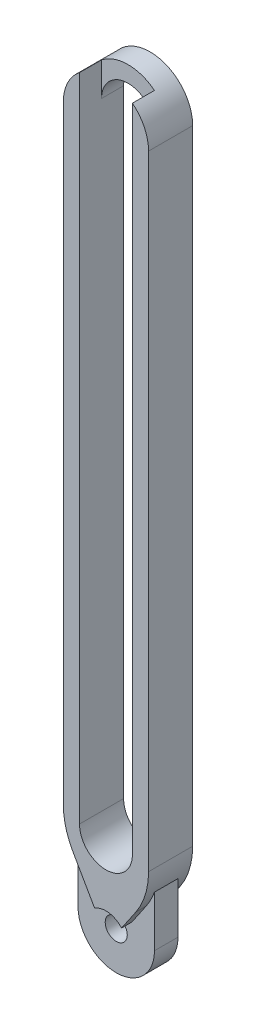
from build123d import *

# Parameters (mm, degrees)
ESTRUSIONE_ESTRUSIONE1_DEPTH = 7.5
ESTRUSIONE_ESTRUSIONE2_DEPTH = 4
TAGLIO_ESTRUSIONE1_DEPTH     = 198.380910943
TAGLIO_ESTRUSIONE2_DEPTH     = 198.380910943
RACCORDO1_R                  = 25
FORO_PER_VITE_M6_5_1_D       = 7.5
TAGLIO_ESTRUSIONE3_DEPTH     = 7.5
TAGLIO_ESTRUSIONE4_DEPTH     = 7.5


with BuildPart() as part:
    # Schizzo1 → Estrusione-Estrusione1 (new, symmetric)
    with BuildSketch(Plane.XY):
        with BuildLine():
            Line((14.5, 182.011383906), (14.5, -37.988616094))
            ThreePointArc((14.5, -37.988616094), (0, -52.488616094), (-14.5, -37.988616094))
            Line((-14.5, -37.988616094), (-14.5, 182.011383906))
            ThreePointArc((-14.5, 182.011383906), (0, 196.511383906), (14.5, 182.011383906))
        make_face()
    extrude(amount=ESTRUSIONE_ESTRUSIONE1_DEPTH, both=True)

    # Schizzo2 → Estrusione-Estrusione2 (add, symmetric)
    with BuildSketch(Plane.XY):
        with BuildLine():
            Line((13, -40.066616094), (13, -56.066616094))
            ThreePointArc((13, -56.066616094), (0, -69.066616094), (-13, -56.066616094))
            Line((-13, -56.066616094), (-13, -40.066616094))
            ThreePointArc((-13, -40.066616094), (0, -27.066616094), (13, -40.066616094))
        make_face()
    extrude(amount=ESTRUSIONE_ESTRUSIONE2_DEPTH, both=True)

    # Schizzo4 → Taglio-Estrusione1 (cut, through all)
    with BuildSketch(Plane.XY.offset(4)):
        with BuildLine():
            Line((5.29445937, -51.487456784), (14.5, -37.988616094))
            Line((14.5, -37.988616094), (21.494330869, -44.738036439))
            Line((21.494330869, -44.738036439), (5.386515672, -60.537124892))
            ThreePointArc((5.386515672, -60.537124892), (0.071202698, -63.066253954), (-5.29445937, -60.645775404))
            Line((-5.29445937, -60.645775404), (-28.596127717, -39.453615031))
            Line((-28.596127717, -39.453615031), (-14.5, -31.562211214))
            Line((-14.5, -31.562211214), (-3.845832517, -50.217721134))
            ThreePointArc((-3.845832517, -50.217721134), (0.963165144, -49.133196093), (5.29445937, -51.487456784))
        make_face()
    taglio_estrusione1 = extrude(amount=TAGLIO_ESTRUSIONE1_DEPTH, mode=Mode.SUBTRACT)

    # Specchia1: Taglio-Estrusione1 across plane
    add(taglio_estrusione1.mirror(Plane.XY), mode=Mode.SUBTRACT)

    # Schizzo5 → Taglio-Estrusione2 (cut, through all)
    with BuildSketch(Plane.XY.offset(4)):
        Polygon((-13, -44.411232383), (-13, -34.188720036), (-15.056335757, -30.588064032), (-15.056335757, -43.619366988), align=None)
        Polygon((13, -44.411232383), (13, -40.188189356), (17.407959402, -33.724436261), (17.407959402, -44.411232383), align=None)
    extrude(amount=-TAGLIO_ESTRUSIONE2_DEPTH, mode=Mode.SUBTRACT)

    # Raccordo1
    # the kernel refuses this fillet: 25 mm, written as the material it takes off along each edge
    with BuildSketch(Plane(origin=(-14.5, -31.562211214, -24.089497944), x_dir=(0.4959240379913526, -0.8683659070589721, 0), z_dir=(0, 0, 1))) as raccordo1_piece_1_section:
        with BuildLine():
            CenterArc((RACCORDO1_R * 0.26543196711, RACCORDO1_R), RACCORDO1_R, 240.269299078, 29.730700922)
            Line((-RACCORDO1_R * 0.230492070882, RACCORDO1_R * 0.131634092941), (0, 0))
            Line((0, 0), (RACCORDO1_R * 0.26543196711, 0))
        make_face()
    raccordo1_piece_1 = extrude(amount=48.178995889, mode=Mode.PRIVATE)
    raccordo1_piece_1 = split(raccordo1_piece_1, bisect_by=Plane(origin=(-13, -35.788331904, -14.044748972), z_dir=(1, 0, 0)), keep=Keep.TOP, mode=Mode.PRIVATE)
    raccordo1_piece_1 = split(raccordo1_piece_1, bisect_by=Plane(origin=(-12.28179921, -35.788331904, -4), z_dir=(0, 0, -1)), keep=Keep.TOP, mode=Mode.PRIVATE)
    add(raccordo1_piece_1, mode=Mode.SUBTRACT)
    with BuildSketch(Plane(origin=(-14.5, -31.562211214, -24.089497944), x_dir=(0.4959240379913526, -0.8683659070589721, 0), z_dir=(0, 0, 1))) as raccordo1_piece_2_section:
        with BuildLine():
            CenterArc((RACCORDO1_R * 0.26543196711, RACCORDO1_R), RACCORDO1_R, 240.269299078, 29.730700922)
            Line((-RACCORDO1_R * 0.230492070882, RACCORDO1_R * 0.131634092941), (0, 0))
            Line((0, 0), (RACCORDO1_R * 0.26543196711, 0))
        make_face()
    raccordo1_piece_2 = extrude(amount=48.178995889, mode=Mode.PRIVATE)
    raccordo1_piece_2 = split(raccordo1_piece_2, bisect_by=Plane(origin=(-13, -30.370530988, -14.044748972), z_dir=(-1, 0, 0)), keep=Keep.TOP, mode=Mode.PRIVATE)
    raccordo1_piece_2 = split(raccordo1_piece_2, bisect_by=Plane(origin=(-14.266276842, -30.370530988, -4), z_dir=(0, 0, -1)), keep=Keep.TOP, mode=Mode.PRIVATE)
    add(raccordo1_piece_2, mode=Mode.SUBTRACT)
    with BuildSketch(Plane(origin=(-14.5, -31.562211214, -24.089497944), x_dir=(0.4959240379913526, -0.8683659070589721, 0), z_dir=(0, 0, 1))) as raccordo1_piece_3_section:
        with BuildLine():
            CenterArc((RACCORDO1_R * 0.26543196711, RACCORDO1_R), RACCORDO1_R, 240.269299078, 29.730700922)
            Line((-RACCORDO1_R * 0.230492070882, RACCORDO1_R * 0.131634092941), (0, 0))
            Line((0, 0), (RACCORDO1_R * 0.26543196711, 0))
        make_face()
    raccordo1_piece_3 = extrude(amount=48.178995889, mode=Mode.PRIVATE)
    raccordo1_piece_3 = split(raccordo1_piece_3, bisect_by=Plane(origin=(-14.266276842, -30.370530988, 4), z_dir=(0, 0, -1)), keep=Keep.TOP, mode=Mode.PRIVATE)
    raccordo1_piece_3 = split(raccordo1_piece_3, bisect_by=Plane(origin=(-13, -30.370530988, 0), z_dir=(-1, 0, 0)), keep=Keep.TOP, mode=Mode.PRIVATE)
    raccordo1_piece_3 = split(raccordo1_piece_3, bisect_by=Plane(origin=(-14.266276842, -30.370530988, -4), z_dir=(0, 0, 1)), keep=Keep.TOP, mode=Mode.PRIVATE)
    add(raccordo1_piece_3, mode=Mode.SUBTRACT)
    with BuildSketch(Plane(origin=(-14.5, -31.562211214, -24.089497944), x_dir=(0.4959240379913526, -0.8683659070589721, 0), z_dir=(0, 0, 1))) as raccordo1_piece_4_section:
        with BuildLine():
            CenterArc((RACCORDO1_R * 0.26543196711, RACCORDO1_R), RACCORDO1_R, 240.269299078, 29.730700922)
            Line((-RACCORDO1_R * 0.230492070882, RACCORDO1_R * 0.131634092941), (0, 0))
            Line((0, 0), (RACCORDO1_R * 0.26543196711, 0))
        make_face()
    raccordo1_piece_4 = extrude(amount=48.178995889, mode=Mode.PRIVATE)
    raccordo1_piece_4 = split(raccordo1_piece_4, bisect_by=Plane(origin=(-12.28179921, -35.788331904, 4), z_dir=(0, 0, 1)), keep=Keep.TOP, mode=Mode.PRIVATE)
    raccordo1_piece_4 = split(raccordo1_piece_4, bisect_by=Plane(origin=(-13, -35.788331904, 14.044748972), z_dir=(1, 0, 0)), keep=Keep.TOP, mode=Mode.PRIVATE)
    add(raccordo1_piece_4, mode=Mode.SUBTRACT)
    with BuildSketch(Plane(origin=(-14.5, -31.562211214, -24.089497944), x_dir=(0.4959240379913526, -0.8683659070589721, 0), z_dir=(0, 0, 1))) as raccordo1_piece_5_section:
        with BuildLine():
            CenterArc((RACCORDO1_R * 0.26543196711, RACCORDO1_R), RACCORDO1_R, 240.269299078, 29.730700922)
            Line((-RACCORDO1_R * 0.230492070882, RACCORDO1_R * 0.131634092941), (0, 0))
            Line((0, 0), (RACCORDO1_R * 0.26543196711, 0))
        make_face()
    raccordo1_piece_5 = extrude(amount=48.178995889, mode=Mode.PRIVATE)
    raccordo1_piece_5 = split(raccordo1_piece_5, bisect_by=Plane(origin=(-14.266276842, -30.370530988, 4), z_dir=(0, 0, 1)), keep=Keep.TOP, mode=Mode.PRIVATE)
    raccordo1_piece_5 = split(raccordo1_piece_5, bisect_by=Plane(origin=(-13, -30.370530988, 14.044748972), z_dir=(-1, 0, 0)), keep=Keep.TOP, mode=Mode.PRIVATE)
    add(raccordo1_piece_5, mode=Mode.SUBTRACT)
    with BuildSketch(Plane(origin=(14.5, -37.988616094, 26.782481556), x_dir=(0, 1, 0), z_dir=(0, 0, -1))) as raccordo1_piece_6_section:
        with BuildLine():
            CenterArc((RACCORDO1_R * 0.308519704891, -RACCORDO1_R), RACCORDO1_R, 90, 34.292050498)
            Line((-RACCORDO1_R * 0.254891721625, -RACCORDO1_R * 0.173823527041), (0, 0))
            Line((0, 0), (RACCORDO1_R * 0.308519704891, 0))
        make_face()
    raccordo1_piece_6 = extrude(amount=53.564963111, mode=Mode.PRIVATE)
    raccordo1_piece_6 = split(raccordo1_piece_6, bisect_by=Plane(origin=(14.242102238, -36.251699178, 4), z_dir=(0, 0, 1)), keep=Keep.TOP, mode=Mode.PRIVATE)
    raccordo1_piece_6 = split(raccordo1_piece_6, bisect_by=Plane(origin=(13, -36.251699178, 15.391240778), z_dir=(1, 0, 0)), keep=Keep.TOP, mode=Mode.PRIVATE)
    add(raccordo1_piece_6, mode=Mode.SUBTRACT)
    with BuildSketch(Plane(origin=(14.5, -37.988616094, 26.782481556), x_dir=(0, 1, 0), z_dir=(0, 0, -1))) as raccordo1_piece_7_section:
        with BuildLine():
            CenterArc((RACCORDO1_R * 0.308519704891, -RACCORDO1_R), RACCORDO1_R, 90, 34.292050498)
            Line((-RACCORDO1_R * 0.254891721625, -RACCORDO1_R * 0.173823527041), (0, 0))
            Line((0, 0), (RACCORDO1_R * 0.308519704891, 0))
        make_face()
    raccordo1_piece_7 = extrude(amount=53.564963111, mode=Mode.PRIVATE)
    raccordo1_piece_7 = split(raccordo1_piece_7, bisect_by=Plane(origin=(11.895384145, -41.966992208, 4), z_dir=(0, 0, 1)), keep=Keep.TOP, mode=Mode.PRIVATE)
    raccordo1_piece_7 = split(raccordo1_piece_7, bisect_by=Plane(origin=(13, -41.966992208, 15.391240778), z_dir=(-1, 0, 0)), keep=Keep.TOP, mode=Mode.PRIVATE)
    add(raccordo1_piece_7, mode=Mode.SUBTRACT)
    with BuildSketch(Plane(origin=(14.5, -37.988616094, 26.782481556), x_dir=(0, 1, 0), z_dir=(0, 0, -1))) as raccordo1_piece_8_section:
        with BuildLine():
            CenterArc((RACCORDO1_R * 0.308519704891, -RACCORDO1_R), RACCORDO1_R, 90, 34.292050498)
            Line((-RACCORDO1_R * 0.254891721625, -RACCORDO1_R * 0.173823527041), (0, 0))
            Line((0, 0), (RACCORDO1_R * 0.308519704891, 0))
        make_face()
    raccordo1_piece_8 = extrude(amount=53.564963111, mode=Mode.PRIVATE)
    raccordo1_piece_8 = split(raccordo1_piece_8, bisect_by=Plane(origin=(14.242102238, -36.251699178, 4), z_dir=(0, 0, -1)), keep=Keep.TOP, mode=Mode.PRIVATE)
    raccordo1_piece_8 = split(raccordo1_piece_8, bisect_by=Plane(origin=(14.242102238, -36.251699178, -4), z_dir=(0, 0, 1)), keep=Keep.TOP, mode=Mode.PRIVATE)
    raccordo1_piece_8 = split(raccordo1_piece_8, bisect_by=Plane(origin=(13, -36.251699178, 0), z_dir=(1, 0, 0)), keep=Keep.TOP, mode=Mode.PRIVATE)
    add(raccordo1_piece_8, mode=Mode.SUBTRACT)
    with BuildSketch(Plane(origin=(14.5, -37.988616094, 26.782481556), x_dir=(0, 1, 0), z_dir=(0, 0, -1))) as raccordo1_piece_9_section:
        with BuildLine():
            CenterArc((RACCORDO1_R * 0.308519704891, -RACCORDO1_R), RACCORDO1_R, 90, 34.292050498)
            Line((-RACCORDO1_R * 0.254891721625, -RACCORDO1_R * 0.173823527041), (0, 0))
            Line((0, 0), (RACCORDO1_R * 0.308519704891, 0))
        make_face()
    raccordo1_piece_9 = extrude(amount=53.564963111, mode=Mode.PRIVATE)
    raccordo1_piece_9 = split(raccordo1_piece_9, bisect_by=Plane(origin=(14.242102238, -36.251699178, -4), z_dir=(0, 0, -1)), keep=Keep.TOP, mode=Mode.PRIVATE)
    raccordo1_piece_9 = split(raccordo1_piece_9, bisect_by=Plane(origin=(13, -36.251699178, -15.391240778), z_dir=(1, 0, 0)), keep=Keep.TOP, mode=Mode.PRIVATE)
    add(raccordo1_piece_9, mode=Mode.SUBTRACT)
    with BuildSketch(Plane(origin=(14.5, -37.988616094, 26.782481556), x_dir=(0, 1, 0), z_dir=(0, 0, -1))) as raccordo1_piece_10_section:
        with BuildLine():
            CenterArc((RACCORDO1_R * 0.308519704891, -RACCORDO1_R), RACCORDO1_R, 90, 34.292050498)
            Line((-RACCORDO1_R * 0.254891721625, -RACCORDO1_R * 0.173823527041), (0, 0))
            Line((0, 0), (RACCORDO1_R * 0.308519704891, 0))
        make_face()
    raccordo1_piece_10 = extrude(amount=53.564963111, mode=Mode.PRIVATE)
    raccordo1_piece_10 = split(raccordo1_piece_10, bisect_by=Plane(origin=(11.895384145, -41.966992208, -4), z_dir=(0, 0, -1)), keep=Keep.TOP, mode=Mode.PRIVATE)
    raccordo1_piece_10 = split(raccordo1_piece_10, bisect_by=Plane(origin=(13, -41.966992208, -15.391240778), z_dir=(-1, 0, 0)), keep=Keep.TOP, mode=Mode.PRIVATE)
    add(raccordo1_piece_10, mode=Mode.SUBTRACT)

    # Foro per Vite M6.5-1 (through all)
    with Locations(Plane(origin=(0, -56.066616094, 4), x_dir=(1, 0, 0), z_dir=(0, 0, 1))):
        with Locations((0, 0)):
            Hole(FORO_PER_VITE_M6_5_1_D / 2)

    # Schizzo8 → Taglio-Estrusione3 (cut, symmetric)
    with BuildSketch(Plane.XY):
        with BuildLine():
            Line((9, 182.011383906), (9, -27.988616094))
            ThreePointArc((9, -27.988616094), (0, -36.988616094), (-9, -27.988616094))
            Line((-9, -27.988616094), (-9, 182.011383906))
            ThreePointArc((-9, 182.011383906), (0, 191.011383906), (9, 182.011383906))
        make_face()
    extrude(amount=TAGLIO_ESTRUSIONE3_DEPTH, both=True, mode=Mode.SUBTRACT)

    # Schizzo9 → Taglio-Estrusione4 (cut)
    with BuildSketch(Plane.XY.offset(7.5)):
        with BuildLine():
            Line((-9, 182.011383906), (-9, 202.011383906))
            ThreePointArc((-9, 202.011383906), (0, 211.011383906), (9, 202.011383906))
            Line((9, 202.011383906), (9, 182.011383906))
            ThreePointArc((9, 182.011383906), (0, 173.011383906), (-9, 182.011383906))
        make_face()
    extrude(amount=-TAGLIO_ESTRUSIONE4_DEPTH, mode=Mode.SUBTRACT)


solid = part.part
